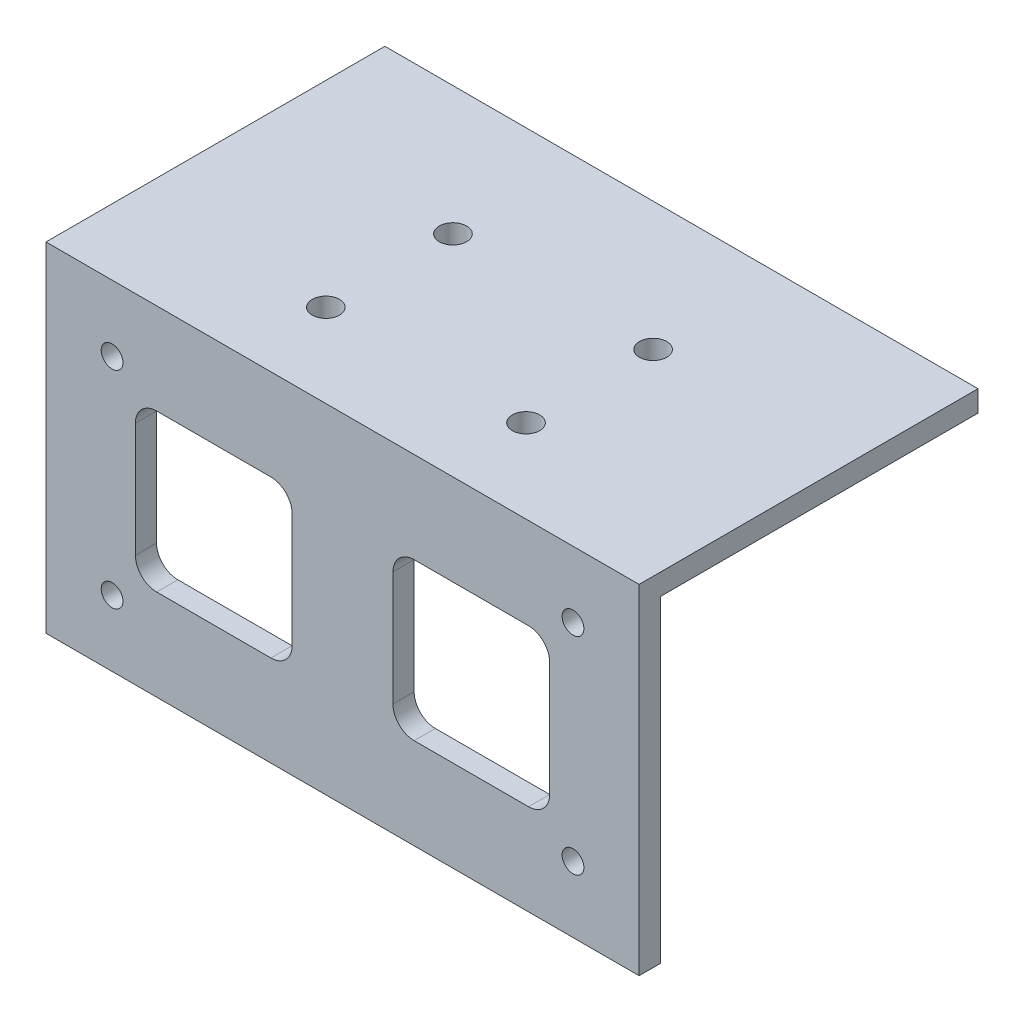
from build123d import *

# Parameters (mm, degrees)
SKETCH1_W           = 177.8
SKETCH1_H           = 101.6
SKETCH1_R           = 3.2639
SKETCH1_W_2         = 46.99
SKETCH1_H_2         = 46.99
BOSS_EXTRUDE2_DEPTH = 6.35
SKETCH2_W           = 177.8
SKETCH2_H           = 6.35
BOSS_EXTRUDE3_DEPTH = 95.25
FILLET1_R           = 6.35
SKETCH3_R           = 4.1021
CUT_EXTRUDE1_DEPTH  = 166.222070257


with BuildPart() as part:
    # Sketch1 → Boss-Extrude2 (new body)
    with BuildSketch(Plane.XY):
        Rectangle(SKETCH1_W, SKETCH1_H)
        with Locations((-69.088, -30.988)):
            Circle(SKETCH1_R, mode=Mode.SUBTRACT)
        with Locations((69.088, -30.988)):
            Circle(SKETCH1_R, mode=Mode.SUBTRACT)
        with Locations((-38.608, 0)):
            Rectangle(SKETCH1_W_2, SKETCH1_H_2, mode=Mode.SUBTRACT)
        with Locations((-69.088, 30.988)):
            Circle(SKETCH1_R, mode=Mode.SUBTRACT)
        with Locations((38.608, 0)):
            Rectangle(SKETCH1_W_2, SKETCH1_H_2, mode=Mode.SUBTRACT)
        with Locations((69.088, 30.988)):
            Circle(SKETCH1_R, mode=Mode.SUBTRACT)
    extrude(amount=BOSS_EXTRUDE2_DEPTH)

    # Sketch2 → Boss-Extrude3 (add)
    with BuildSketch(Plane(origin=(0, 0, 0), x_dir=(-1, 0, 0), z_dir=(0, 0, -1))):
        with Locations((0, 47.625)):
            Rectangle(SKETCH2_W, SKETCH2_H)
    extrude(amount=BOSS_EXTRUDE3_DEPTH)

    # Fillet1
    fillet1_edges = [part.edges().sort_by_distance(p)[0] for p in [
        (-62.103, -23.495, 3.175),
        (15.113, -23.495, 3.175),
        (15.113, 23.495, 3.175),
        (62.103, 23.495, 3.175),
        (62.103, -23.495, 3.175),
        (-15.113, -23.495, 3.175),
        (-15.113, 23.495, 3.175),
        (-62.103, 23.495, 3.175),
    ]]
    fillet(fillet1_edges, radius=FILLET1_R)

    # Sketch3 → Cut-Extrude1 (cut, through all)
    with BuildSketch(Plane(origin=(0, 50.8, 0), x_dir=(1, 0, 0), z_dir=(0, 1, 0))):
        with Locations((-30, 18.65)):
            Circle(SKETCH3_R)
        with Locations((-30, 56.75)):
            Circle(SKETCH3_R)
        with Locations((30, 18.65)):
            Circle(SKETCH3_R)
        with Locations((30, 56.75)):
            Circle(SKETCH3_R)
    extrude(amount=-CUT_EXTRUDE1_DEPTH, mode=Mode.SUBTRACT)


solid = part.part
